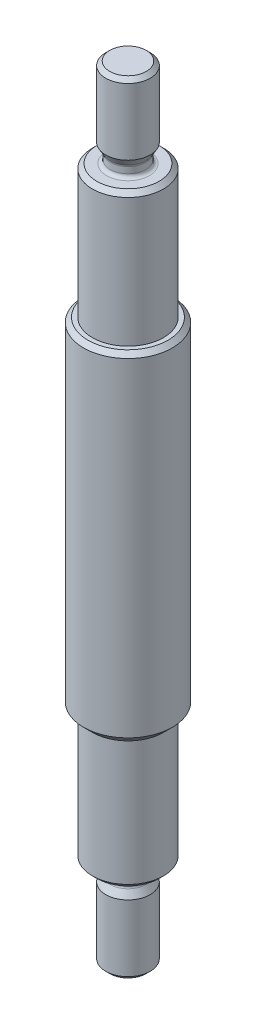
from build123d import *

# Parameters (mm, degrees)
SKETCH1_R           = 5
BOSS_EXTRUDE1_DEPTH = 19
SKETCH2_R           = 4
BOSS_EXTRUDE2_DEPTH = 15
BOSS_EXTRUDE3_START = -53
SKETCH2_2_R         = 4
BOSS_EXTRUDE3_DEPTH = 15
CHAMFER2_SIZE       = 0.5
SKETCH5_R           = 2.6
BOSS_EXTRUDE4_DEPTH = 10
SKETCH7_R           = 2.6
BOSS_EXTRUDE5_DEPTH = 10


# Read off the part's stored shape, not the designer's step: M5 Machine Threads Stud3, M5 Machine Threads Stud4
with BuildPart() as part:
    # Sketch1 → Boss-Extrude1 (new, symmetric)
    with BuildSketch(Plane(origin=(0, 0, 0), x_dir=(1, 0, 0), z_dir=(0, 1, 0))):
        with Locations(Location((0, 0, 0), (0, 0, 270))):
            Circle(SKETCH1_R)
    extrude(amount=BOSS_EXTRUDE1_DEPTH, both=True)

    # Sketch2 → Boss-Extrude2 (add)
    with BuildSketch(Plane(origin=(0, 19, 0), x_dir=(1, 0, 0), z_dir=(0, 1, 0))):
        with Locations(Location((0, 0, 0), (0, 0, 270))):
            Circle(SKETCH2_R)
    extrude(amount=BOSS_EXTRUDE2_DEPTH)

    # Sketch2<2> → Boss-Extrude3 (add)
    with BuildSketch(Plane(origin=(0, 19, 0), x_dir=(1, 0, 0), z_dir=(0, 1, 0)).offset(BOSS_EXTRUDE3_START)):
        with Locations(Location((0, 0, 0), (0, 0, 270))):
            Circle(SKETCH2_2_R)
    extrude(amount=BOSS_EXTRUDE3_DEPTH)

    # Chamfer2
    chamfer2_edges = [part.edges().sort_by_distance(p)[0] for p in [
        (0, -34, -4),
        (0, -19, -4),
        (0, -19, -5),
        (0, 19, -5),
        (0, 34, -4),
    ]]
    chamfer(chamfer2_edges, length=CHAMFER2_SIZE - 0.0001)  # a hair under: the kernel refuses the full size

    # Sketch5 → Boss-Extrude4 (add)
    with BuildSketch(Plane.XZ.offset(34)):
        with Locations(Location((0, 0, 0), (0, 0, 270))):
            Circle(SKETCH5_R)
    extrude(amount=BOSS_EXTRUDE4_DEPTH)

    # M5 Machine Threads Stud3 outline → M5 Machine Threads Stud3 (revolve, cut)
    with BuildSketch(Plane.XY):
        with BuildLine():
            Line((2.6, -44), (2.6, -34))
            Line((2.6, -34), (2.4, -34))
            ThreePointArc((2.4, -34), (2.117157288, -34.117157288), (2, -34.4))
            Line((2, -34.4), (2, -35.1))
            ThreePointArc((2, -35.1), (2.013629669, -35.203527618), (2.053589838, -35.3))
            Line((2.053589838, -35.3), (2.5, -36.073205081))
            Line((2.5, -36.073205081), (2.5, -43.555))
            Line((2.5, -43.555), (2.055, -44))
            Line((2.055, -44), (2.6, -44))
        make_face()
    revolve(axis=Axis((0, 0, 0), (0, 1, 0)), mode=Mode.SUBTRACT)

    # Sketch7 → Boss-Extrude5 (add)
    with BuildSketch(Plane(origin=(0, 34, 0), x_dir=(1, 0, 0), z_dir=(0, 1, 0))):
        with Locations(Location((0, 0, 0), (0, 0, 270))):
            Circle(SKETCH7_R)
    extrude(amount=BOSS_EXTRUDE5_DEPTH)

    # M5 Machine Threads Stud4 outline → M5 Machine Threads Stud4 (revolve, cut)
    with BuildSketch(Plane.XY):
        with BuildLine():
            Line((2.6, 44), (2.055, 44))
            Line((2.055, 44), (2.5, 43.555))
            Line((2.5, 43.555), (2.5, 36.073205081))
            Line((2.5, 36.073205081), (2.053589838, 35.3))
            ThreePointArc((2.053589838, 35.3), (2.013629669, 35.203527618), (2, 35.1))
            Line((2, 35.1), (2, 34.4))
            ThreePointArc((2, 34.4), (2.117157288, 34.117157288), (2.4, 34))
            Line((2.4, 34), (2.6, 34))
            Line((2.6, 34), (2.6, 44))
        make_face()
    revolve(axis=Axis((0, 0, 0), (0, 1, 0)), mode=Mode.SUBTRACT)


solid = part.part
